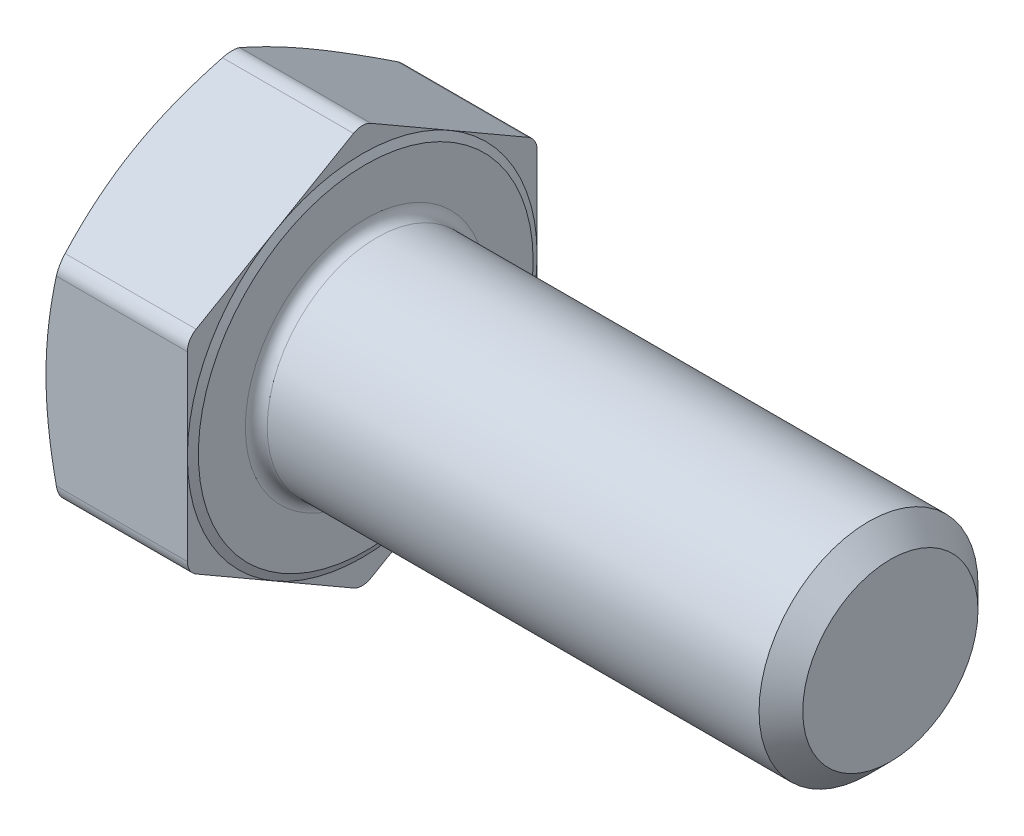
from build123d import *

# Parameters (mm, degrees)
SKETCH2_R                = 3.9751
BOSS_EXTRUDE1_DEPTH      = 19.05
BOSS_EXTRUDE2_DEPTH      = 5.55625
SKETCH5_OUTSIDE_W        = 44.798
SKETCH5_OUTSIDE_H        = 46.762
SKETCH5_OUTSIDE_R        = 5.715
CUT_EXTRUDE1_DEPTH       = 5.55625
CUT_EXTRUDE1_DRAFT       = -65
BOSS_EXTRUDE5_DEPTH      = 0.0635
FILLET5_R                = 0.0635
CIRPATTERN1_COUNT        = 6
FILLET5_OF_CIRPATTERN1_R = 0.0635
FILLET7_R                = 0.635
CHAMFER1_SIZE            = 0.79375
FILLET4_R                = 0.39751


with BuildPart() as part:
    # Sketch2 → Boss-Extrude1 (new body)
    with BuildSketch(Plane(origin=(0, 0, 0), x_dir=(0, 0, -1), z_dir=(1, 0, 0))):
        with Locations(Location((0, 0, 0), (0, 0, 180))):
            Circle(SKETCH2_R)
    extrude(amount=BOSS_EXTRUDE1_DEPTH)

    # Sketch3 → Boss-Extrude2 (add)
    with BuildSketch(Plane.ZY):
        Polygon((0, 7.332348419), (-6.35, 3.666174209), (-6.35, -3.666174209), (0, -7.332348419), (6.35, -3.666174209), (6.35, 3.666174209), align=None)
    extrude(amount=BOSS_EXTRUDE2_DEPTH)


with BuildPart() as cut_extrude1_tool:
    # Sketch5 outside → Cut-Extrude1 (with draft: the straight prism first)
    with BuildSketch(Plane.ZY.offset(5.55625)):
        Rectangle(SKETCH5_OUTSIDE_W, SKETCH5_OUTSIDE_H)
        Circle(SKETCH5_OUTSIDE_R, mode=Mode.SUBTRACT)
    extrude(amount=-CUT_EXTRUDE1_DEPTH)
    # Cut-Extrude1: the draft: its side faces are tilted about the plane it starts from
    cut_extrude1_sides = [cut_extrude1_tool.faces().sort_by_distance(p)[0] for p in [
        (-2.778125, -23.381, 0),
        (-2.778125, 0, 22.399),
        (-2.778125, 23.381, 0),
        (-2.778125, 0, -22.399),
        (-2.778125, 0, -5.715),
    ]]
    draft(cut_extrude1_sides, Plane.ZY.offset(5.55625), CUT_EXTRUDE1_DRAFT)


with BuildPart() as part_1:
    add(part.part)

    # Cut-Extrude1: cut by cut_extrude1_tool
    add(cut_extrude1_tool.part, mode=Mode.SUBTRACT)

    # Sketch11 → Boss-Extrude5 (add)
    with BuildSketch(Plane.ZY.offset(5.55625)):
        with BuildLine():
            Line((0.254, 4.5085), (0.254, 2.794))
            ThreePointArc((0.254, 2.794), (0, 2.54), (-0.254, 2.794))
            Line((-0.254, 2.794), (-0.254, 4.5085))
            ThreePointArc((-0.254, 4.5085), (0, 4.7625), (0.254, 4.5085))
        make_face()
    boss_extrude5 = extrude(amount=BOSS_EXTRUDE5_DEPTH)

    # Fillet5
    fillet5_edges = [part_1.edges().sort_by_distance(p)[0] for p in [
        (-5.61975, 3.65125, 0.254),
        (-5.61975, 2.54, 0),
        (-5.61975, 3.65125, -0.254),
        (-5.61975, 4.7625, 0),
    ]]
    fillet(fillet5_edges, radius=FILLET5_R - 0.0001)  # a hair under: the kernel refuses the full size

    # CirPattern1: Boss-Extrude5 ×6 about axis
    cirpattern1_axis = Axis((0, 0, 0), (1, 0, 0))
    for i in range(1, CIRPATTERN1_COUNT):
        add(boss_extrude5.rotate(cirpattern1_axis, i * 360 / CIRPATTERN1_COUNT))

    # Fillet5 of CirPattern1
    fillet5_of_cirpattern1_edges = [part_1.edges().sort_by_distance(p)[0] for p in [
        (-5.61975, 1.605654547, 3.289075256),
        (-5.61975, 1.27, 2.199704526),
        (-5.61975, 2.045595453, 3.035075256),
        (-5.61975, 2.38125, 4.124445986),
        (-5.61975, -2.045595453, 3.035075256),
        (-5.61975, -1.27, 2.199704526),
        (-5.61975, -1.605654547, 3.289075256),
        (-5.61975, -2.38125, 4.124445986),
        (-5.61975, -3.65125, -0.254),
        (-5.61975, -2.54, 0),
        (-5.61975, -3.65125, 0.254),
        (-5.61975, -4.7625, 0),
        (-5.61975, -1.605654547, -3.289075256),
        (-5.61975, -1.27, -2.199704526),
        (-5.61975, -2.045595453, -3.035075256),
        (-5.61975, -2.38125, -4.124445986),
        (-5.61975, 2.045595453, -3.035075256),
        (-5.61975, 1.27, -2.199704526),
        (-5.61975, 1.605654547, -3.289075256),
        (-5.61975, 2.38125, -4.124445986),
    ]]
    fillet(fillet5_of_cirpattern1_edges, radius=FILLET5_OF_CIRPATTERN1_R - 0.0001)  # a hair under: the kernel refuses the full size

    # Fillet7
    fillet7_edges = [part_1.edges().sort_by_distance(p)[0] for p in [
        (-2.401034023, -7.332348419, 0),
        (-2.401034023, -3.666174209, -6.35),
        (-2.401034023, 3.666174209, -6.35),
        (-2.401034023, 7.332348419, 0),
        (-2.401034023, -3.666174209, 6.35),
        (-2.401034023, 3.666174209, 6.35),
    ]]
    fillet(fillet7_edges, radius=FILLET7_R)

    # Chamfer1
    chamfer1_edges = [part_1.edges().sort_by_distance(p)[0] for p in [
        (19.05, 0, -3.9751),
    ]]
    chamfer(chamfer1_edges, length=CHAMFER1_SIZE)

    # Sketch15 → Cut-Revolve1 (revolve, cut)
    with BuildSketch(Plane.XY, mode=Mode.PRIVATE) as cut_revolve1_sk:
        Polygon((0, 6.077647621), (-0.127, 6.35), (-0.127, 7.332348419), (0, 7.332348419), align=None)
    revolve(cut_revolve1_sk.sketch.rotate(Axis((0, 0, 0), (-1, 0, 0)), 210), axis=Axis((0, 0, 0), (-1, 0, 0)), mode=Mode.SUBTRACT)

    # Fillet4
    fillet4_edges = [part_1.edges().sort_by_distance(p)[0] for p in [
        (0, 0, -3.9751),
    ]]
    fillet(fillet4_edges, radius=FILLET4_R)


solid = part_1.part
